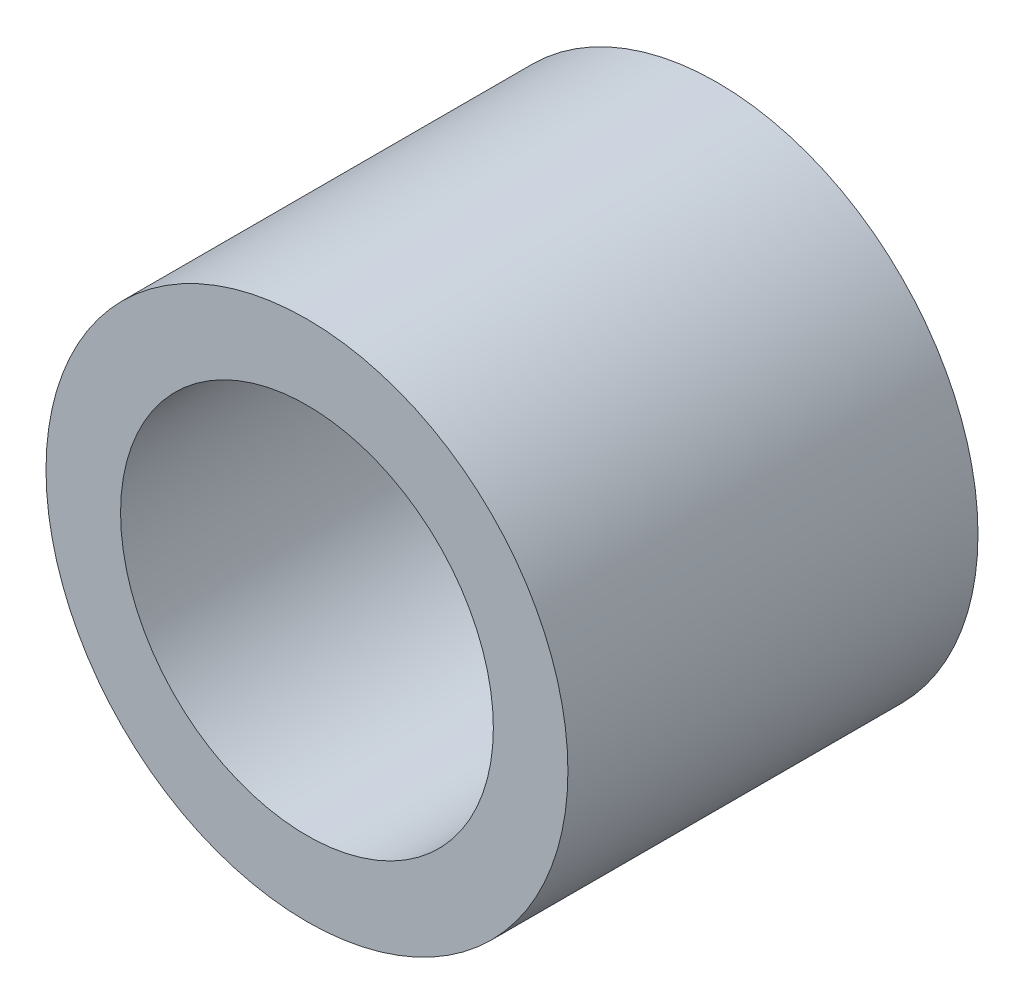
from build123d import *

# Parameters (mm, degrees)
SKETCH1_R           = 4.445
SKETCH1_R_2         = 3.175
BOSS_EXTRUDE1_DEPTH = 6.985


with BuildPart() as part:
    # Sketch1 → Boss-Extrude1 (new body)
    with BuildSketch(Plane.XY):
        Circle(SKETCH1_R)
        Circle(SKETCH1_R_2, mode=Mode.SUBTRACT)
    extrude(amount=BOSS_EXTRUDE1_DEPTH)


solid = part.part
